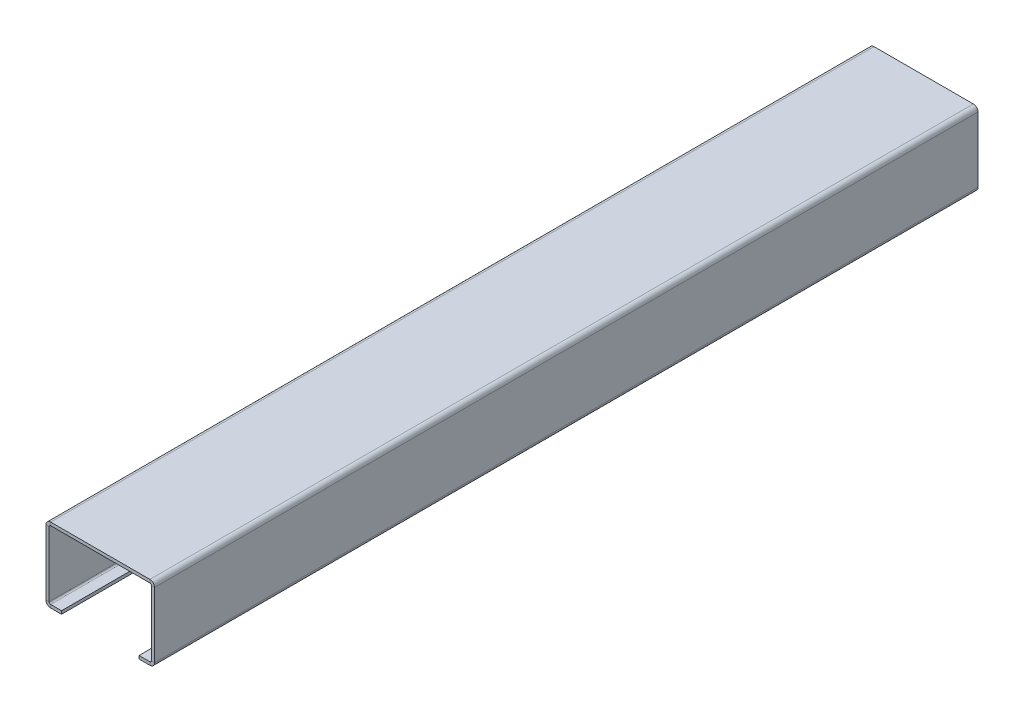
from build123d import *

# Parameters (mm, degrees)
BASEFLANGE_W                   = 70
BASEFLANGE_H                   = 531
BASE_FLANGE1_DEPTH             = 2
EDGE_FLANGE1_STRIP_W           = 10
EDGE_FLANGE1_STRIP_H           = 2
EDGE_FLANGE1_STRIP_CUT_DEPTH   = 531
EDGE_FLANGE1_STRIP_2_W         = 10
EDGE_FLANGE1_STRIP_2_H         = 2
EDGE_FLANGE1_STRIP_CUT_2_DEPTH = 531
EDGE_FLANGE1_DEPTH             = 531
EDGE_FLANGE1_BEND_DEPTH        = 531
EDGE_FLANGE2_STRIP_W           = 10
EDGE_FLANGE2_STRIP_H           = 2
EDGE_FLANGE2_STRIP_CUT_DEPTH   = 531
EDGE_FLANGE2_STRIP_2_W         = 10
EDGE_FLANGE2_STRIP_2_H         = 2
EDGE_FLANGE2_STRIP_CUT_2_DEPTH = 531
EDGE_FLANGE2_DEPTH             = 531
EDGE_FLANGE2_BEND_DEPTH        = 531


# Sheet-metal steps are written as plain solids
with BuildPart() as part:
    # BaseFlange → Base-Flange1 (new body)
    with BuildSketch(Plane(origin=(0, 0, 0), x_dir=(1, 0, 0), z_dir=(0, 1, 0))):
        with Locations((0, -265.5)):
            Rectangle(BASEFLANGE_W, BASEFLANGE_H)
    extrude(amount=-BASE_FLANGE1_DEPTH)

    # Edge-Flange1 strip (across the edge) → Edge-Flange1 strip cut (cut)
    with BuildSketch(Plane(origin=(-35, -2, 531), x_dir=(1, 0, 0), z_dir=(0, 0, -1))):
        with Locations((-2, -1)):
            Rectangle(EDGE_FLANGE1_STRIP_W, EDGE_FLANGE1_STRIP_H)
    extrude(amount=EDGE_FLANGE1_STRIP_CUT_DEPTH, mode=Mode.SUBTRACT)

    # Edge-Flange1 strip 2 (across the edge) → Edge-Flange1 strip cut 2 (cut)
    with BuildSketch(Plane(origin=(35, -2, 0), x_dir=(-1, 0, 0), z_dir=(0, 0, 1))):
        with Locations((-2, -1)):
            Rectangle(EDGE_FLANGE1_STRIP_2_W, EDGE_FLANGE1_STRIP_2_H)
    extrude(amount=EDGE_FLANGE1_STRIP_CUT_2_DEPTH, mode=Mode.SUBTRACT)

    # Edge-Flange1 section (across the edge) → Edge-Flange1 (add)
    with BuildSketch(Plane(origin=(-35, -2, 531), x_dir=(1, 0, 0), z_dir=(0, 0, -1))):
        with BuildLine():
            Line((0, 1), (0, 46))
            Line((0, 46), (2, 46))
            Line((2, 46), (2, 1))
            ThreePointArc((2, 1), (2.292893219, 0.292893219), (3, 0))
            Line((3, 0), (3, -2))
            ThreePointArc((3, -2), (0.878679656, -1.121320344), (0, 1))
        make_face()
    extrude(amount=EDGE_FLANGE1_DEPTH)

    # Edge-Flange1 section 2 (across the edge) → Edge-Flange1 bend (add)
    with BuildSketch(Plane(origin=(35, -2, 0), x_dir=(-1, 0, 0), z_dir=(0, 0, 1))):
        with BuildLine():
            Line((0, 1), (0, 46))
            Line((0, 46), (2, 46))
            Line((2, 46), (2, 1))
            ThreePointArc((2, 1), (2.292893219, 0.292893219), (3, 0))
            Line((3, 0), (3, -2))
            ThreePointArc((3, -2), (0.878679656, -1.121320344), (0, 1))
        make_face()
    extrude(amount=EDGE_FLANGE1_BEND_DEPTH)

    # Edge-Flange2 strip (across the edge) → Edge-Flange2 strip cut (cut)
    with BuildSketch(Plane(origin=(-33, -48, 531), x_dir=(0, 1, 0), z_dir=(0, 0, -1))):
        with Locations((-2, -1)):
            Rectangle(EDGE_FLANGE2_STRIP_W, EDGE_FLANGE2_STRIP_H)
    extrude(amount=EDGE_FLANGE2_STRIP_CUT_DEPTH, mode=Mode.SUBTRACT)

    # Edge-Flange2 strip 2 (across the edge) → Edge-Flange2 strip cut 2 (cut)
    with BuildSketch(Plane(origin=(33, -48, 0), x_dir=(0, 1, 0), z_dir=(0, 0, 1))):
        with Locations((-2, -1)):
            Rectangle(EDGE_FLANGE2_STRIP_2_W, EDGE_FLANGE2_STRIP_2_H)
    extrude(amount=EDGE_FLANGE2_STRIP_CUT_2_DEPTH, mode=Mode.SUBTRACT)

    # Edge-Flange2 section (across the edge) → Edge-Flange2 (add)
    with BuildSketch(Plane(origin=(-33, -48, 531), x_dir=(0, 1, 0), z_dir=(0, 0, -1))):
        with BuildLine():
            Line((0, 1), (0, 8))
            Line((0, 8), (2, 8))
            Line((2, 8), (2, 1))
            ThreePointArc((2, 1), (2.292893219, 0.292893219), (3, 0))
            Line((3, 0), (3, -2))
            ThreePointArc((3, -2), (0.878679656, -1.121320344), (0, 1))
        make_face()
    extrude(amount=EDGE_FLANGE2_DEPTH)

    # Edge-Flange2 section 2 (across the edge) → Edge-Flange2 bend (add)
    with BuildSketch(Plane(origin=(33, -48, 0), x_dir=(0, 1, 0), z_dir=(0, 0, 1))):
        with BuildLine():
            Line((0, 1), (0, 8))
            Line((0, 8), (2, 8))
            Line((2, 8), (2, 1))
            ThreePointArc((2, 1), (2.292893219, 0.292893219), (3, 0))
            Line((3, 0), (3, -2))
            ThreePointArc((3, -2), (0.878679656, -1.121320344), (0, 1))
        make_face()
    extrude(amount=EDGE_FLANGE2_BEND_DEPTH)


solid = part.part
